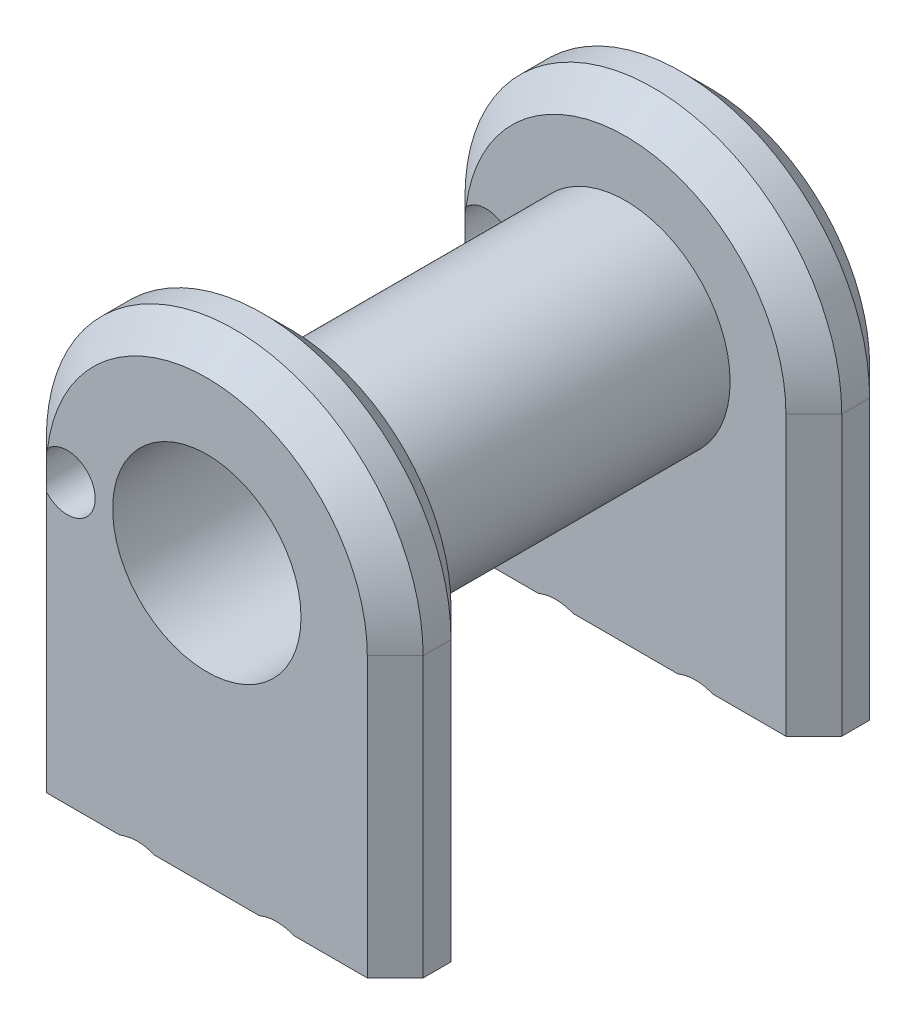
from build123d import *

# Parameters (mm, degrees)
BOSS_EXTRUDE1_DEPTH = 6
SKETCH2_R           = 7.5
BOSS_EXTRUDE2_DEPTH = 24
BOSS_EXTRUDE3_DEPTH = 6
SKETCH4_R           = 6.75
CUT_EXTRUDE1_DEPTH  = 44.338781709
SKETCH5_R           = 2.25
CUT_EXTRUDE2_DEPTH  = 13
CHAMFER1_SIZE       = 1
CHAMFER2_SIZE       = 2
SKETCH6_R           = 2
CUT_EXTRUDE3_DEPTH  = 44.338781709


with BuildPart() as part:
    # Sketch1 → Boss-Extrude1 (new body)
    with BuildSketch(Plane.XY):
        with BuildLine():
            Line((-13.5, 0), (-13.5, -20))
            Line((-13.5, -20), (13.5, -20))
            Line((13.5, -20), (13.5, 0))
            ThreePointArc((13.5, 0), (0, 13.5), (-13.5, 0))
        make_face()
    extrude(amount=BOSS_EXTRUDE1_DEPTH)

    # Sketch2 → Boss-Extrude2 (add)
    with BuildSketch(Plane.XY.offset(6)):
        Circle(SKETCH2_R)
    extrude(amount=BOSS_EXTRUDE2_DEPTH)

    # Sketch3 → Boss-Extrude3 (add)
    with BuildSketch(Plane.XY.offset(30)):
        with BuildLine():
            Line((-13.5, 0), (-13.5, -20))
            Line((-13.5, -20), (13.5, -20))
            Line((13.5, -20), (13.5, 0))
            ThreePointArc((13.5, 0), (0, 13.5), (-13.5, 0))
        make_face()
    extrude(amount=BOSS_EXTRUDE3_DEPTH)

    # Sketch4 → Cut-Extrude1 (cut, through all)
    with BuildSketch(Plane.XY.offset(36)):
        Circle(SKETCH4_R)
    extrude(amount=-CUT_EXTRUDE1_DEPTH, mode=Mode.SUBTRACT)

    # Sketch5 → Cut-Extrude2 (cut)
    with BuildSketch(Plane.XZ.offset(20)):
        with Locations((-5, 33)):
            Circle(SKETCH5_R)
        with Locations((5, 33)):
            Circle(SKETCH5_R)
        with Locations((-5, 3)):
            Circle(SKETCH5_R)
        with Locations((5, 3)):
            Circle(SKETCH5_R)
    extrude(amount=-CUT_EXTRUDE2_DEPTH, mode=Mode.SUBTRACT)

    # Chamfer1
    # the kernel refuses this chamfer: 1 mm, written as the material it takes off along each edge
    with BuildSketch(Plane(origin=(5, -20, 33), x_dir=(1, 0, 0), z_dir=(0, 0, -1))) as chamfer1_piece_1:
        Polygon((2.25 + CHAMFER1_SIZE, 0), (2.25, -CHAMFER1_SIZE), (2.25, 0), align=None)
    revolve(axis=Axis((5, -20, 33), (0, -1, 0)), mode=Mode.SUBTRACT)
    with BuildSketch(Plane(origin=(-5, -20, 3), x_dir=(1, 0, 0), z_dir=(0, 0, -1))) as chamfer1_piece_2:
        Polygon((2.25 + CHAMFER1_SIZE, 0), (2.25, -CHAMFER1_SIZE), (2.25, 0), align=None)
    revolve(axis=Axis((-5, -20, 3), (0, -1, 0)), mode=Mode.SUBTRACT)
    with BuildSketch(Plane(origin=(5, -20, 3), x_dir=(1, 0, 0), z_dir=(0, 0, -1))) as chamfer1_piece_3:
        Polygon((2.25 + CHAMFER1_SIZE, 0), (2.25, -CHAMFER1_SIZE), (2.25, 0), align=None)
    revolve(axis=Axis((5, -20, 3), (0, -1, 0)), mode=Mode.SUBTRACT)
    with BuildSketch(Plane(origin=(-5, -20, 33), x_dir=(1, 0, 0), z_dir=(0, 0, -1))) as chamfer1_piece_4:
        Polygon((2.25 + CHAMFER1_SIZE, 0), (2.25, -CHAMFER1_SIZE), (2.25, 0), align=None)
    revolve(axis=Axis((-5, -20, 33), (0, -1, 0)), mode=Mode.SUBTRACT)

    # Chamfer2
    chamfer2_edges = [part.edges().sort_by_distance(p)[0] for p in [
        (13.5, -10, 6),
        (0, 13.5, 30),
        (-13.5, -10, 30),
        (13.5, -10, 30),
        (0, 13.5, 36),
        (-13.5, -10, 36),
        (13.5, -10, 36),
        (0, 13.5, 6),
        (13.5, -10, 0),
        (-13.5, -10, 0),
        (0, 13.5, 0),
        (-13.5, -10, 6),
    ]]
    chamfer(chamfer2_edges, length=CHAMFER2_SIZE)

    # Sketch6 → Cut-Extrude3 (cut, through all)
    with BuildSketch(Plane.XY.offset(36)):
        with Locations(Location((-10, 0, 0), (0, 0, 221.409622109))):
            Circle(SKETCH6_R)
    extrude(amount=-CUT_EXTRUDE3_DEPTH, mode=Mode.SUBTRACT)


solid = part.part
